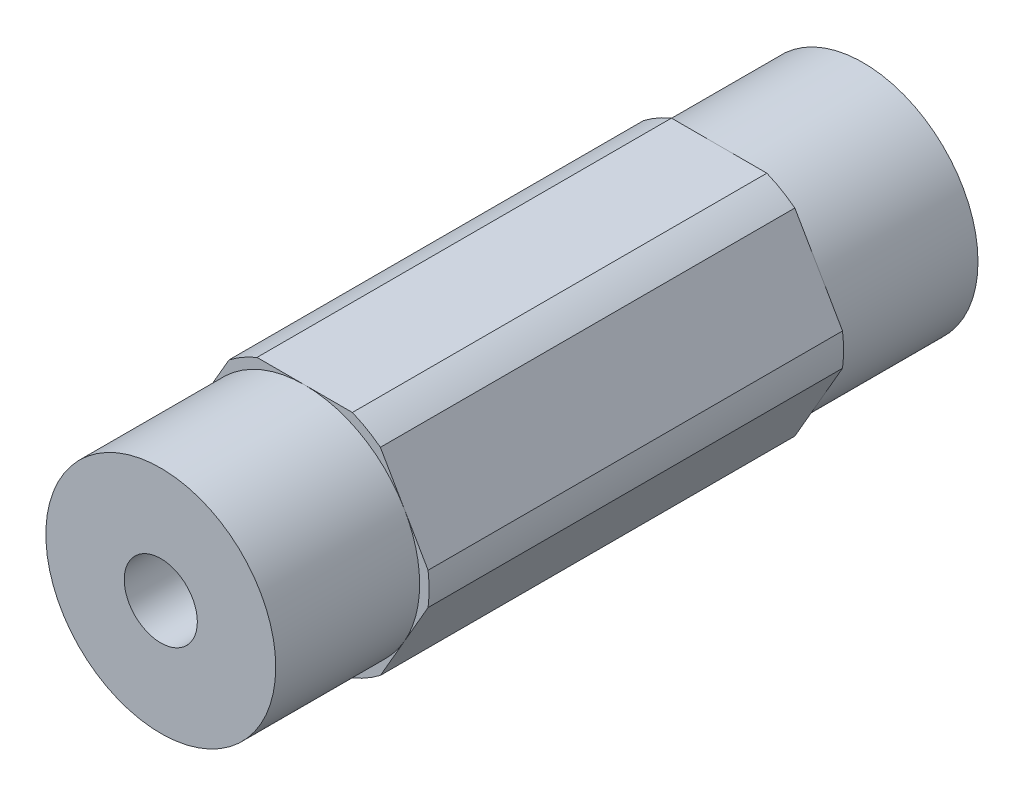
from build123d import *

# Parameters (mm, degrees)
BOSS_EXTRUDE1_DEPTH = 19.39925
SKETCH2_OUTSIDE_W   = 25.34
SKETCH2_OUTSIDE_H   = 23.376
SKETCH2_OUTSIDE_R   = 6.35
CUT_EXTRUDE2_DEPTH  = 7.9502
SKETCH3_OUTSIDE_W   = 25.34
SKETCH3_OUTSIDE_H   = 23.376
SKETCH3_OUTSIDE_R   = 6.875
CUT_EXTRUDE4_DEPTH  = 40.992617263
SKETCH4_R           = 2.0193
CUT_EXTRUDE5_DEPTH  = 40.911298241


with BuildPart() as part:
    # Sketch1 → Boss-Extrude1 (new, symmetric)
    with BuildSketch(Plane.XY):
        Polygon((7.332348419, 0), (3.666174209, 6.35), (-3.666174209, 6.35), (-7.332348419, 0), (-3.666174209, -6.35), (3.666174209, -6.35), align=None)
    extrude(amount=BOSS_EXTRUDE1_DEPTH, both=True)

    # Sketch2 outside → Cut-Extrude2 (cut)
    with BuildSketch(Plane.XY.offset(19.39925)):
        Rectangle(SKETCH2_OUTSIDE_W, SKETCH2_OUTSIDE_H)
        Circle(SKETCH2_OUTSIDE_R, mode=Mode.SUBTRACT)
    cut_extrude2 = extrude(amount=-CUT_EXTRUDE2_DEPTH, mode=Mode.SUBTRACT)

    # Sketch3 outside → Cut-Extrude4 (cut, through all)
    with BuildSketch(Plane.XY.offset(19.39925)):
        Rectangle(SKETCH3_OUTSIDE_W, SKETCH3_OUTSIDE_H)
        Circle(SKETCH3_OUTSIDE_R, mode=Mode.SUBTRACT)
    extrude(amount=-CUT_EXTRUDE4_DEPTH, mode=Mode.SUBTRACT)

    # Mirror1: Cut-Extrude2 across plane
    add(cut_extrude2.mirror(Plane.XY), mode=Mode.SUBTRACT)

    # Sketch4 → Cut-Extrude5 (cut, through all)
    with BuildSketch(Plane.XY.offset(19.39925)):
        Circle(SKETCH4_R)
    extrude(amount=-CUT_EXTRUDE5_DEPTH, mode=Mode.SUBTRACT)


solid = part.part
